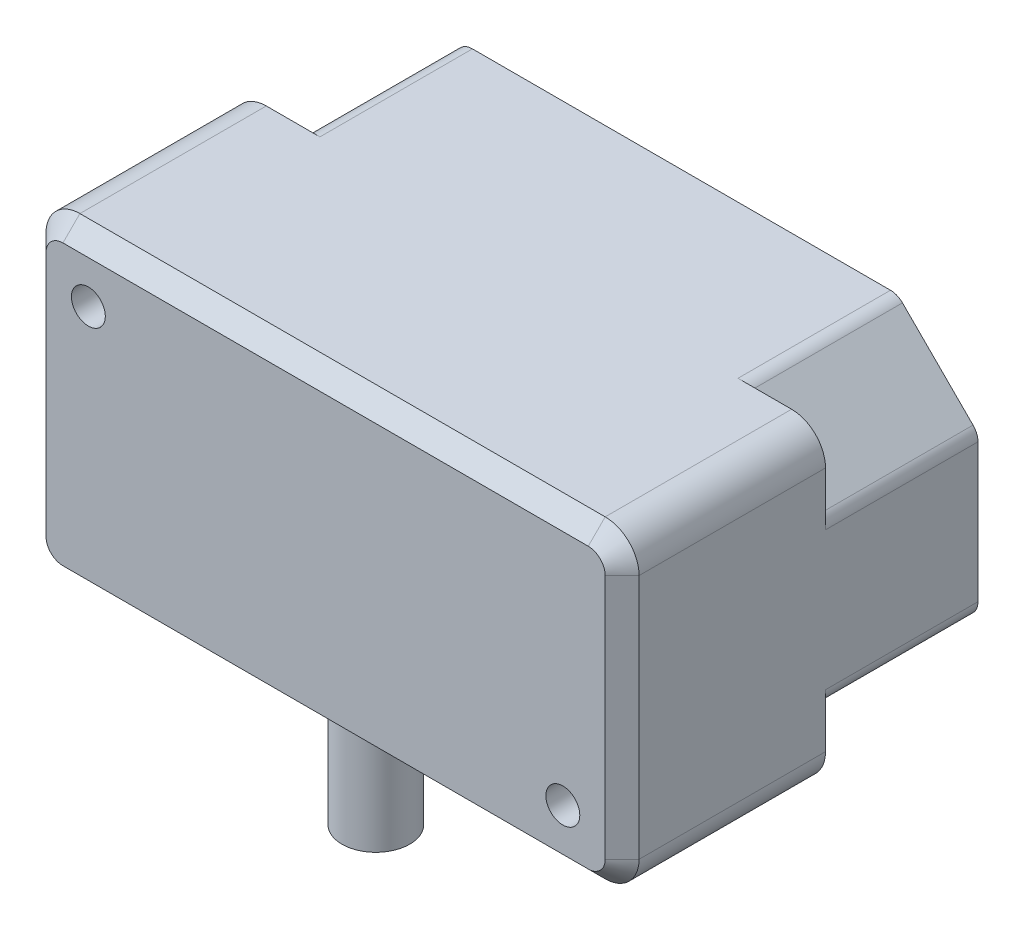
from build123d import *

# Parameters (mm, degrees)
ESQUISSE1_W             = 35
ESQUISSE1_H             = 18.5
BOSS_EXTRU_1_DEPTH      = 21
CONG_1_R                = 2
ESQUISSE2_R             = 1
ENL_V_MAT_EXTRU_1_DEPTH = 4
ESQUISSE3_OUTSIDE_W     = 45.962
ESQUISSE3_OUTSIDE_H     = 29.462
ENL_V_MAT_EXTRU_2_DEPTH = 9
CONG_2_R                = 1
ENL_V_MAT_EXTRU_3_DEPTH = 0.5
ESQUISSE5_R             = 2
BOSS_EXTRU_2_DEPTH      = 6
CHANFREIN1_SIZE         = 1


with BuildPart() as part:
    # Esquisse1 → Boss.-Extru.1 (new body)
    with BuildSketch(Plane.XY):
        Rectangle(ESQUISSE1_W, ESQUISSE1_H)
    extrude(amount=BOSS_EXTRU_1_DEPTH)

    # Congé1
    cong_1_edges = [part.edges().sort_by_distance(p)[0] for p in [
        (-17.5, 9.25, 10.5),
        (17.5, 9.25, 10.5),
        (17.5, -9.25, 10.5),
        (-17.5, -9.25, 10.5),
    ]]
    fillet(cong_1_edges, radius=CONG_1_R)

    # Esquisse2 → Enlèv. mat.-Extru.1 (cut)
    with BuildSketch(Plane.XY.offset(21)):
        with Locations((-14, 5.75)):
            Circle(ESQUISSE2_R)
        with Locations((14, -5.75)):
            Circle(ESQUISSE2_R)
    extrude(amount=-ENL_V_MAT_EXTRU_1_DEPTH, mode=Mode.SUBTRACT)

    # Esquisse3 outside → Enlèv. mat.-Extru.2 (cut)
    with BuildSketch(Plane(origin=(0, 0, 0), x_dir=(-1, 0, 0), z_dir=(0, 0, -1))):
        Rectangle(ESQUISSE3_OUTSIDE_W, ESQUISSE3_OUTSIDE_H)
        Polygon((-17.5, 4.5), (-12.75, 9.25), (12.75, 9.25), (17.5, 4.5), (17.5, -4.5), (12.75, -9.25), (-12.75, -9.25), (-17.5, -4.5), align=None, mode=Mode.SUBTRACT)
    extrude(amount=-ENL_V_MAT_EXTRU_2_DEPTH, mode=Mode.SUBTRACT)

    # Congé2
    cong_2_edges = [part.edges().sort_by_distance(p)[0] for p in [
        (17.5, 4.5, 4.5),
        (12.75, 9.25, 4.5),
        (-12.75, 9.25, 4.5),
        (-17.5, 4.5, 4.5),
        (-17.5, -4.5, 4.5),
        (-12.75, -9.25, 4.5),
        (12.75, -9.25, 4.5),
        (17.5, -4.5, 4.5),
    ]]
    fillet(cong_2_edges, radius=CONG_2_R)

    # Esquisse4 → Enlèv. mat.-Extru.3 (cut)
    with BuildSketch(Plane(origin=(0, 0, 0), x_dir=(-1, 0, 0), z_dir=(0, 0, -1))):
        with BuildLine():
            Line((-0.25, 8.75), (-0.25, -8.75))
            Line((-0.25, -8.75), (-12.335786438, -8.75))
            ThreePointArc((-12.335786438, -8.75), (-12.527128154, -8.711939766), (-12.689339828, -8.603553391))
            Line((-12.689339828, -8.603553391), (-16.853553391, -4.439339828))
            ThreePointArc((-16.853553391, -4.439339828), (-16.961939766, -4.277128154), (-17, -4.085786438))
            Line((-17, -4.085786438), (-17, 4.085786438))
            ThreePointArc((-17, 4.085786438), (-16.961939766, 4.277128154), (-16.853553391, 4.439339828))
            Line((-16.853553391, 4.439339828), (-12.689339828, 8.603553391))
            ThreePointArc((-12.689339828, 8.603553391), (-12.527128154, 8.711939766), (-12.335786438, 8.75))
            Line((-12.335786438, 8.75), (-0.25, 8.75))
        make_face()
        with BuildLine():
            Line((0.25, 8.75), (0.25, -8.75))
            Line((0.25, -8.75), (12.335786438, -8.75))
            ThreePointArc((12.335786438, -8.75), (12.527128154, -8.711939766), (12.689339828, -8.603553391))
            Line((12.689339828, -8.603553391), (16.853553391, -4.439339828))
            ThreePointArc((16.853553391, -4.439339828), (16.961939766, -4.277128154), (17, -4.085786438))
            Line((17, -4.085786438), (17, 4.085786438))
            ThreePointArc((17, 4.085786438), (16.961939766, 4.277128154), (16.853553391, 4.439339828))
            Line((16.853553391, 4.439339828), (12.689339828, 8.603553391))
            ThreePointArc((12.689339828, 8.603553391), (12.527128154, 8.711939766), (12.335786438, 8.75))
            Line((12.335786438, 8.75), (0.25, 8.75))
        make_face()
    extrude(amount=-ENL_V_MAT_EXTRU_3_DEPTH, mode=Mode.SUBTRACT)

    # Esquisse5 → Boss.-Extru.2 (add)
    with BuildSketch(Plane.XZ.offset(9.25)):
        with Locations(Location((-0.035714286, 18, 0), (0, 0, 180))):
            Circle(ESQUISSE5_R)
    extrude(amount=BOSS_EXTRU_2_DEPTH)

    # Chanfrein1
    chanfrein1_edges = [part.edges().sort_by_distance(p)[0] for p in [
        (0, -9.25, 21),
        (-17.5, 0, 21),
        (17.5, 0, 21),
        (0, 9.25, 21),
        (16.914213562, 8.664213562, 21),
        (-16.914213562, 8.664213562, 21),
        (16.914213562, -8.664213562, 21),
        (-16.914213562, -8.664213562, 21),
    ]]
    chamfer(chanfrein1_edges, length=CHANFREIN1_SIZE - 0.0001)  # a hair under: the kernel refuses the full size


solid = part.part
